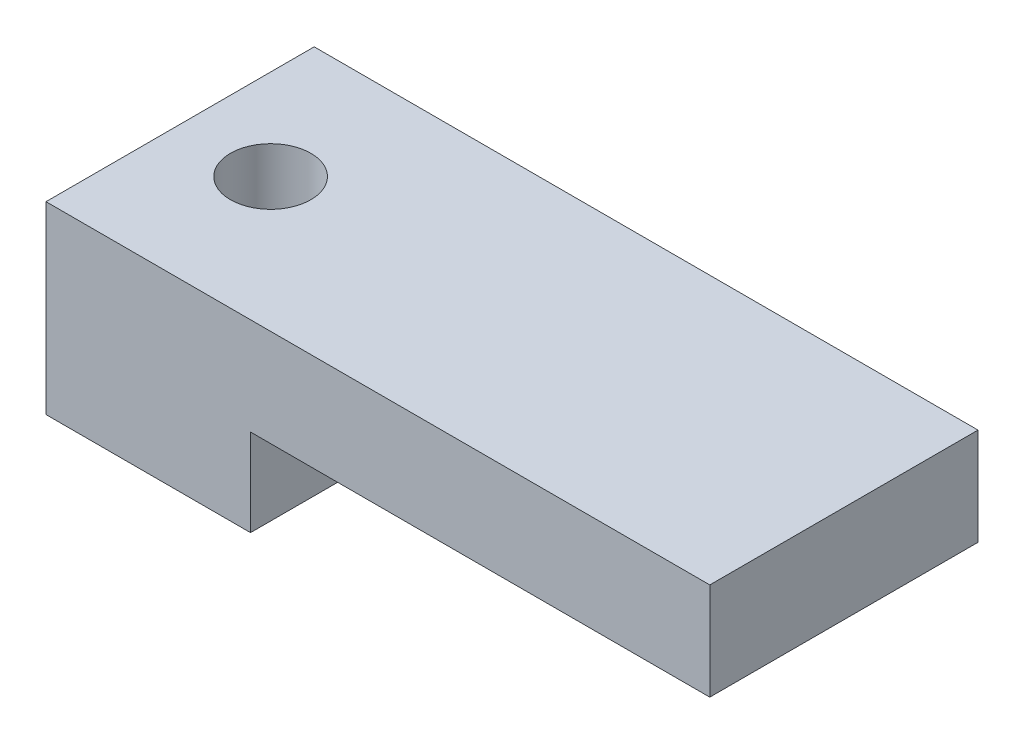
from build123d import *

# Parameters (mm, degrees)
BOSS_EXTRUDE2_DEPTH     = 4
CUT_EXTRUDE2_DEPTH      = 21.935376758
CUT_EXTRUDE2_DEPTH_BACK = 21.935376758
SKETCH2_R               = 1.2


with BuildPart() as part:
    # Sketch1 → Boss-Extrude2 (new, symmetric)
    with BuildSketch(Plane.XY):
        Polygon((0, 0), (6.1, 0), (6.1, 2.6), (19.8, 2.6), (19.8, 5.5), (0, 5.5), align=None)
    extrude(amount=BOSS_EXTRUDE2_DEPTH, both=True)

    # Sketch2 → Cut-Extrude2 (cut, two sides: drawn at the far end of the back side and taken through both)
    with BuildSketch(Plane(origin=(0, 0, 0), x_dir=(1, 0, 0), z_dir=(0, 1, 0)).offset(-CUT_EXTRUDE2_DEPTH_BACK)):
        with Locations((2.7, 0)):
            Circle(SKETCH2_R)
    extrude(amount=CUT_EXTRUDE2_DEPTH + CUT_EXTRUDE2_DEPTH_BACK, mode=Mode.SUBTRACT)


solid = part.part
